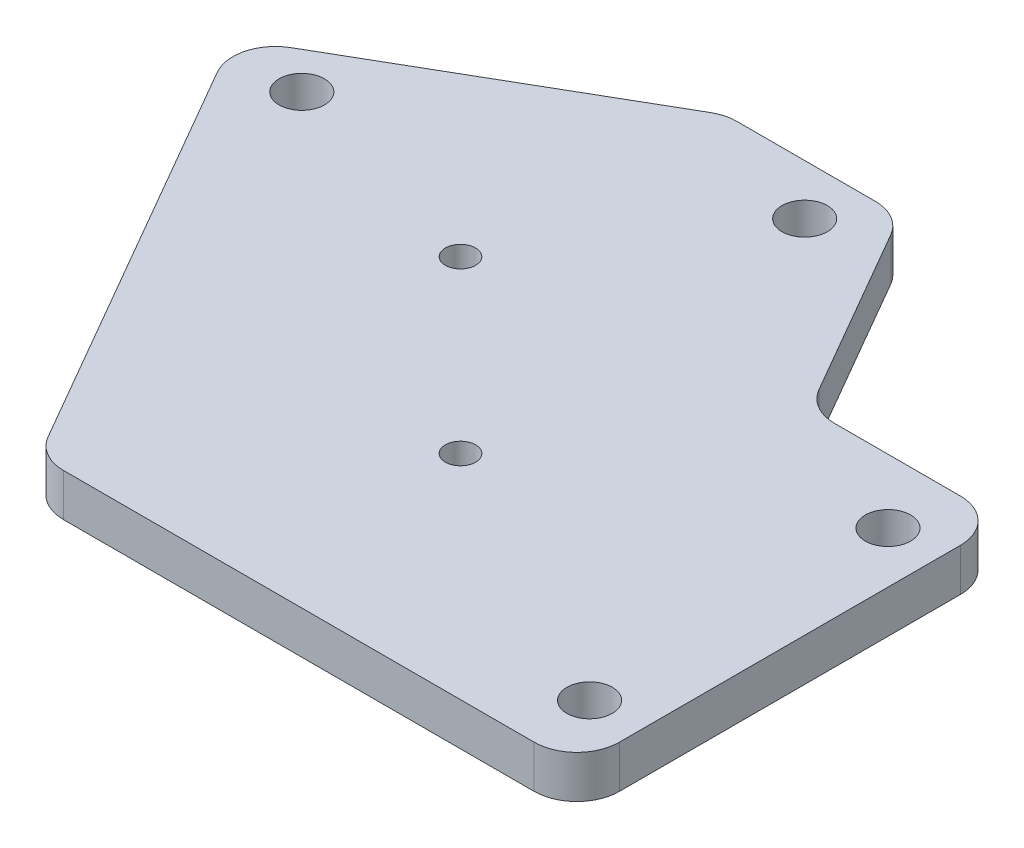
from build123d import *

# Parameters (mm, degrees)
BOSS_EXTRUDE1_DEPTH     = 6.35
FILLET1_R               = 6.35
F_1_4_CLEARANCE_HOLE2_D = 6.7564
F_8_CLEARANCE_HOLE1_D   = 4.4958


with BuildPart() as part:
    # Sketch1 → Boss-Extrude1 (new body)
    with BuildSketch(Plane(origin=(0, 0, 0), x_dir=(1, 0, 0), z_dir=(0, 1, 0))):
        Polygon((-26.866954165, 159.9), (-52.809618943, 159.9), (-99.343756128, 133.03350337), (-59.901828464, 64.718080709), (20.2, 64.718080709), (20.2, 128.218080709), (-8.575389533, 128.218080709), align=None)
    extrude(amount=-BOSS_EXTRUDE1_DEPTH)

    # Fillet1
    fillet1_edges = [part.edges().sort_by_distance(p)[0] for p in [
        (-8.575389533, -3.175, -128.218080709),
        (-99.343756128, -3.175, -133.03350337),
        (-52.809618943, -3.175, -159.9),
        (-26.866954165, -3.175, -159.9),
        (20.2, -3.175, -128.218080709),
        (20.2, -3.175, -64.718080709),
        (-59.901828464, -3.175, -64.718080709),
    ]]
    fillet(fillet1_edges, radius=FILLET1_R)

    # 1/4 Clearance Hole2 (through all)
    with Locations(Plane(origin=(0, -6.35, 0), x_dir=(-1, 0, 0), z_dir=(0, -1, 0))):
        with Locations((87.344864157, 131.300812842), (33.535349774, 152.4), (-12.58, 74.243080709), (-12.58, 118.693080709)):
            Hole(F_1_4_CLEARANCE_HOLE2_D / 2)

    # #8 Clearance Hole1 (through all)
    with Locations(Plane(origin=(0, 0, 0), x_dir=(1, 0, 0), z_dir=(0, 1, 0))):
        with Locations((-54.269039573, 121.866162864), (-28.872875262, 96.469998554)):
            Hole(F_8_CLEARANCE_HOLE1_D / 2)


solid = part.part
